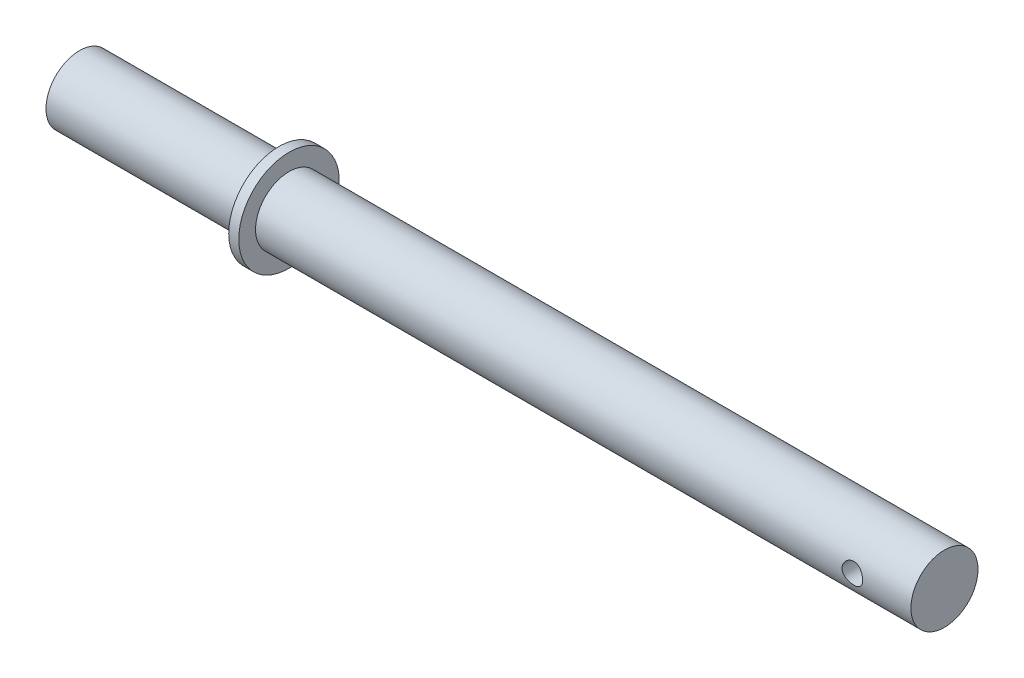
from build123d import *

# Parameters (mm, degrees)
SALIENTE_EXTRUIR1_START           = 8
CROQUIS1_R                        = 10
SALIENTE_EXTRUIR1_DEPTH           = 258
CROQUIS2_R                        = 15
SALIENTE_EXTRUIR2_DEPTH           = 3
CORTAR_EXTRUIR1_REACH             = 268.845
CROQUIS3_R                        = 3.075
CORTAR_EXTRUIR1_DIRECTION_2_REACH = 268.845


with BuildPart() as part:
    # Croquis1 → Saliente-Extruir1 (new body)
    with BuildSketch(Plane(origin=(0, 0, 0), x_dir=(0, 0, -1), z_dir=(1, 0, 0)).offset(SALIENTE_EXTRUIR1_START)):
        Circle(CROQUIS1_R)
    extrude(amount=SALIENTE_EXTRUIR1_DEPTH)

    # Croquis2 → Saliente-Extruir2 (add)
    with BuildSketch(Plane.ZY.offset(-70.5)):
        Circle(CROQUIS2_R)
    extrude(amount=SALIENTE_EXTRUIR2_DEPTH)

    # Croquis3 → Cortar-Extruir1 (cut, up to next)
    with BuildSketch(Plane.XY, mode=Mode.PRIVATE) as cortar_extruir1_sk1:
        with Locations((248.5, 0)):
            Circle(CROQUIS3_R)
    cortar_extruir1_tool1 = extrude(cortar_extruir1_sk1.sketch, amount=-CORTAR_EXTRUIR1_REACH, mode=Mode.PRIVATE) & part.part
    add(cortar_extruir1_tool1.solids().sort_by_distance((248.5, 0, 0))[0], mode=Mode.SUBTRACT)

    # Croquis3 → Cortar-Extruir1 direction 2 (cut, up to next)
    with BuildSketch(Plane.XY, mode=Mode.PRIVATE) as cortar_extruir1_direction_2_sk1:
        with Locations((248.5, 0)):
            Circle(CROQUIS3_R)
    cortar_extruir1_direction_2_tool1 = extrude(cortar_extruir1_direction_2_sk1.sketch, amount=CORTAR_EXTRUIR1_DIRECTION_2_REACH, mode=Mode.PRIVATE) & part.part
    add(cortar_extruir1_direction_2_tool1.solids().sort_by_distance((248.5, 0, 0))[0], mode=Mode.SUBTRACT)


solid = part.part
